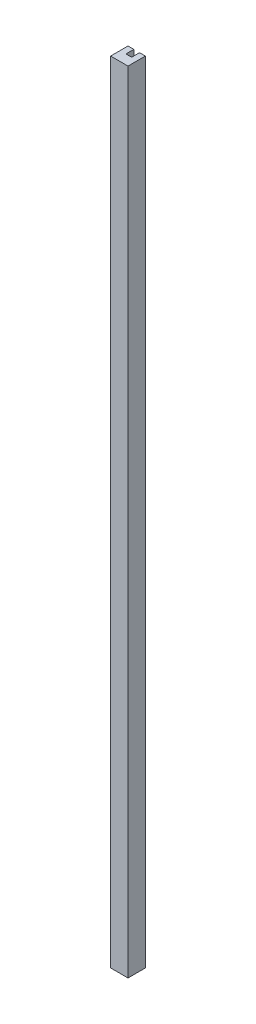
from build123d import *

# Parameters (mm, degrees)
SKETCH1_W           = 55
SKETCH1_H           = 55
BOSS_EXTRUDE1_DEPTH = 2500
SKETCH2_W           = 18
SKETCH2_H           = 2500
CUT_EXTRUDE1_DEPTH  = 25


with BuildPart() as part:
    # Sketch1 → Boss-Extrude1 (new body)
    with BuildSketch(Plane(origin=(0, 0, 0), x_dir=(1, 0, 0), z_dir=(0, 1, 0))):
        Rectangle(SKETCH1_W, SKETCH1_H)
    extrude(amount=BOSS_EXTRUDE1_DEPTH)

    # Sketch2 → Cut-Extrude1 (cut)
    with BuildSketch(Plane(origin=(0, 0, -27.5), x_dir=(-1, 0, 0), z_dir=(0, 0, -1))):
        with Locations((0, 1250)):
            Rectangle(SKETCH2_W, SKETCH2_H)
    extrude(amount=-CUT_EXTRUDE1_DEPTH, mode=Mode.SUBTRACT)


solid = part.part
